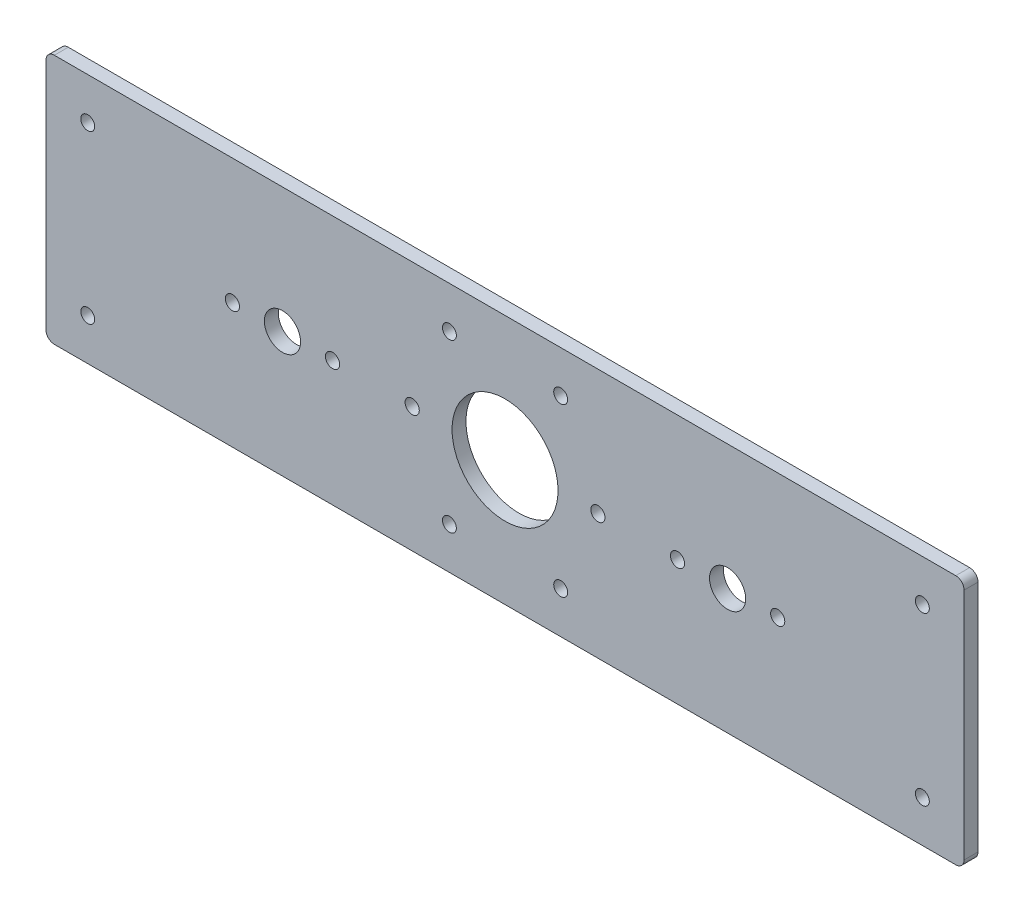
from build123d import *

# Parameters (mm, degrees)
SKETCH1_W           = 330
SKETCH1_H           = 90
SKETCH1_R           = 19.05
SKETCH1_R_2         = 2.55
BOSS_EXTRUDE1_DEPTH = 2.5
SKETCH2_R           = 2.5
CUT_EXTRUDE1_DEPTH  = 172.099386323
SKETCH3_R           = 2.55
SKETCH3_R_2         = 6.5
CUT_EXTRUDE2_DEPTH  = 172.099386323
FILLET1_R           = 3


with BuildPart() as part:
    # Sketch1 → Boss-Extrude1 (new, symmetric)
    with BuildSketch(Plane.XY):
        Rectangle(SKETCH1_W, SKETCH1_H)
        Circle(SKETCH1_R, mode=Mode.SUBTRACT)
        with Locations((-33.375440072, 0)):
            Circle(SKETCH1_R_2, mode=Mode.SUBTRACT)
        with Locations((33.375440072, 0)):
            Circle(SKETCH1_R_2, mode=Mode.SUBTRACT)
    extrude(amount=BOSS_EXTRUDE1_DEPTH, both=True)

    # Sketch2 → Cut-Extrude1 (cut, through all)
    with BuildSketch(Plane.XY.offset(2.5)):
        with Locations((-150, 30)):
            Circle(SKETCH2_R)
        with Locations((-150, -30)):
            Circle(SKETCH2_R)
        with Locations((-20, 30)):
            Circle(SKETCH2_R)
        with Locations((-20, -30)):
            Circle(SKETCH2_R)
        with Locations((20, -30)):
            Circle(SKETCH2_R)
        with Locations((20, 30)):
            Circle(SKETCH2_R)
        with Locations((150, 30)):
            Circle(SKETCH2_R)
        with Locations((150, -30)):
            Circle(SKETCH2_R)
    extrude(amount=-CUT_EXTRUDE1_DEPTH, mode=Mode.SUBTRACT)

    # Sketch3 → Cut-Extrude2 (cut, through all)
    with BuildSketch(Plane.XY.offset(2.5)):
        with Locations((-62, 0)):
            Circle(SKETCH3_R)
        with Locations((-98, 0)):
            Circle(SKETCH3_R)
        with Locations((-80, 0)):
            Circle(SKETCH3_R_2)
    cut_extrude2 = extrude(amount=-CUT_EXTRUDE2_DEPTH, mode=Mode.SUBTRACT)

    # Mirror1: Cut-Extrude2 across plane
    add(cut_extrude2.mirror(Plane(origin=(0, 0, 0), x_dir=(0, 0, 1), z_dir=(1, 0, 0))), mode=Mode.SUBTRACT)

    # Fillet1
    fillet1_edges = [part.edges().sort_by_distance(p)[0] for p in [
        (-165, -45, 0),
        (165, -45, 0),
        (165, 45, 0),
        (-165, 45, 0),
    ]]
    fillet(fillet1_edges, radius=FILLET1_R)


solid = part.part
